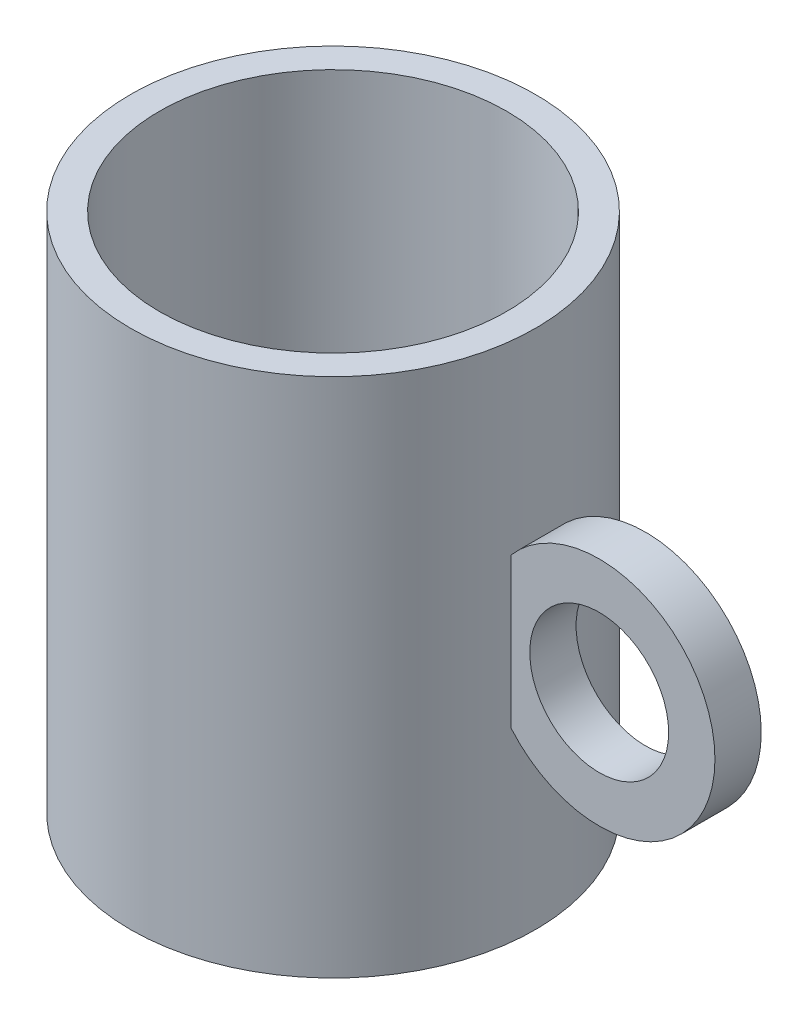
from build123d import *

# Parameters (mm, degrees)
SKETCH_1_R            = 35
EXTRUDE_1_DEPTH       = 90
SKETCH_3_R            = 30
CUT_EXTRUDE_1_DEPTH   = 80
EXTRUDE_START         = -4
EXTRUDE_3_OUTLINE_R   = 20
EXTRUDE_3_OUTLINE_R_2 = 12
EXTRUDE_3_DEPTH       = 8


# Read off the part's stored shape, not the designer's step: 凸台-拉伸3
with BuildPart() as part:
    # 草图1 → 凸台-拉伸1 (new body)
    with BuildSketch(Plane(origin=(0, 0, 0), x_dir=(1, 0, 0), z_dir=(0, 1, 0))):
        with Locations(Location((0, 0, 0), (0, 0, 90))):
            Circle(SKETCH_1_R)
    extrude(amount=EXTRUDE_1_DEPTH)

    # 草图3 → 切除-拉伸1 (cut)
    with BuildSketch(Plane(origin=(0, 90, 0), x_dir=(1, 0, 0), z_dir=(0, 1, 0))):
        with Locations(Location((0, 0, 0), (0, 0, 270))):
            Circle(SKETCH_3_R)
    extrude(amount=-CUT_EXTRUDE_1_DEPTH, mode=Mode.SUBTRACT)

    # 凸台-拉伸3 outline → 凸台-拉伸3 (add)
    with BuildSketch(Plane.XY.offset(EXTRUDE_START)):
        with Locations((50, 45)):
            Circle(EXTRUDE_3_OUTLINE_R)
        with Locations((50, 45)):
            Circle(EXTRUDE_3_OUTLINE_R_2, mode=Mode.SUBTRACT)
    extrude(amount=EXTRUDE_3_DEPTH)


solid = part.part
